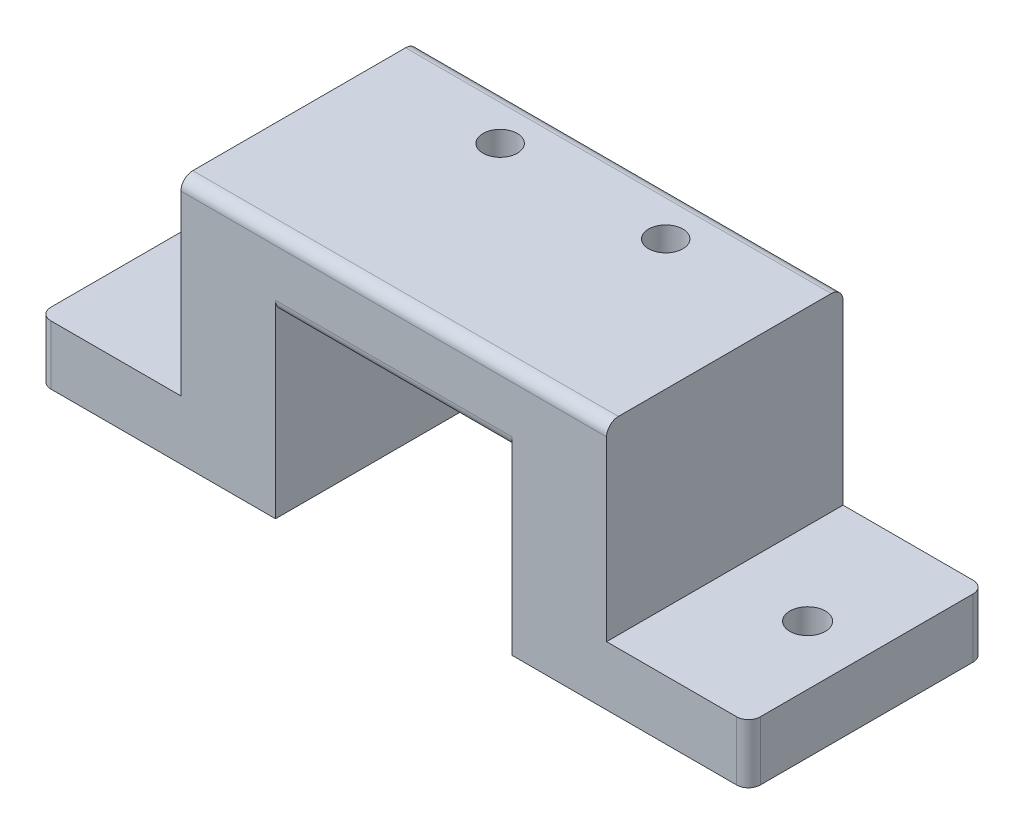
from build123d import *

# Parameters (mm, degrees)
SKETCH1_W             = 20
SKETCH1_H             = 20
SKETCH1_R             = 1.5
BOSS_EXTRUDE1_DEPTH   = 5
BOSS_EXTRUDE1_2_DEPTH = 5
SKETCH2_W             = 8
SKETCH2_H             = 20
BOSS_EXTRUDE2_DEPTH   = 10
SKETCH3_W             = 20
SKETCH3_H             = 6
BOSS_EXTRUDE3_DEPTH   = 36
CUT_EXTRUDE1_DEPTH    = 0.6
SKETCH6_W             = 24.1
SKETCH6_H             = 1.6
CUT_EXTRUDE2_DEPTH    = 17.5
FILLET1_R             = 1
SKETCH8_R             = 1.45
CUT_EXTRUDE3_DEPTH    = 6
FILLET2_R             = 1


# Some blends are built 0.0001 mm under size
with BuildPart() as part:
    # Sketch1 → Boss-Extrude1 (new body)
    with BuildSketch(Plane(origin=(0, 0, 0), x_dir=(1, 0, 0), z_dir=(0, 1, 0))):
        with Locations((-17.614620188, -5)):
            Rectangle(SKETCH1_W, SKETCH1_H)
        with Locations(Location((-22.614620188, -5, 0), (0, 0, 270))):
            Circle(SKETCH1_R, mode=Mode.SUBTRACT)
    extrude(amount=BOSS_EXTRUDE1_DEPTH)



with BuildPart() as body_2:
    # Sketch1 → Boss-Extrude1 2 (new body)
    with BuildSketch(Plane(origin=(0, 0, 0), x_dir=(1, 0, 0), z_dir=(0, 1, 0))):
        with Locations((22.385379812, -5)):
            Rectangle(SKETCH1_W, SKETCH1_H)
        with Locations(Location((27.385379812, -5, 0), (0, 0, 270))):
            Circle(SKETCH1_R, mode=Mode.SUBTRACT)
    extrude(amount=BOSS_EXTRUDE1_2_DEPTH)


with BuildPart() as part_1:
    add(part.part)

    add(body_2.part)  # Boss-Extrude2 merges body 2
    # Sketch2 → Boss-Extrude2 (add)
    with BuildSketch(Plane(origin=(0, 5, 0), x_dir=(1, 0, 0), z_dir=(0, 1, 0))):
        with Locations((-11.614620188, -5)):
            Rectangle(SKETCH2_W, SKETCH2_H)
        with Locations((16.385379812, -5)):
            Rectangle(SKETCH2_W, SKETCH2_H)
    extrude(amount=BOSS_EXTRUDE2_DEPTH)

    # Sketch3 → Boss-Extrude3 (add)
    with BuildSketch(Plane.ZY.offset(15.614620188)):
        with Locations((5, 18)):
            Rectangle(SKETCH3_W, SKETCH3_H)
    extrude(amount=-BOSS_EXTRUDE3_DEPTH)

    # Sketch4 → Cut-Extrude1 (cut)
    with BuildSketch(Plane.XZ.offset(-15)):
        with BuildLine():
            Line((5.635379812, -2.069256579), (5.635379812, -13.54882393))
            Line((5.635379812, -13.54882393), (-0.864620188, -13.54882393))
            Line((-0.864620188, -13.54882393), (-0.864620188, -2.069256579))
            ThreePointArc((-0.864620188, -2.069256579), (-1.168628736, 0.293230663), (-2.06084614, 2.501785681))
            ThreePointArc((-2.06084614, 2.501785681), (2.385379812, 10.1), (6.831605764, 2.501785681))
            ThreePointArc((6.831605764, 2.501785681), (5.93938836, 0.293230663), (5.635379812, -2.069256579))
        make_face()
    extrude(amount=-CUT_EXTRUDE1_DEPTH, mode=Mode.SUBTRACT)

    # Sketch6 → Cut-Extrude2 (cut)
    with BuildSketch(Plane(origin=(0, 0, -5), x_dir=(-1, 0, 0), z_dir=(0, 0, -1))):
        with Locations((-2.335379812, 14.2)):
            Rectangle(SKETCH6_W, SKETCH6_H)
    extrude(amount=-CUT_EXTRUDE2_DEPTH, mode=Mode.SUBTRACT)

    # Fillet1
    fillet1_edges = [part_1.edges().sort_by_distance(p)[0] for p in [
        (2.385379812, 21, -5),
        (2.385379812, 21, 15),
        (32.385379812, 2.5, 15),
        (32.385379812, 2.5, -5),
        (-27.614620188, 2.5, -5),
        (-27.614620188, 2.5, 15),
    ]]
    fillet(fillet1_edges, radius=FILLET1_R)

    # Sketch8 → Cut-Extrude3 (cut)
    with BuildSketch(Plane(origin=(0, 15, 0), x_dir=(-1, 0, 0), z_dir=(0, -1, 0))):
        with Locations(Location((4.614620188, 1, 0), (0, 0, 90))):
            Circle(SKETCH8_R)
        with Locations(Location((-9.385379812, 1, 0), (0, 0, 90))):
            Circle(SKETCH8_R)
    extrude(amount=-CUT_EXTRUDE3_DEPTH, mode=Mode.SUBTRACT)

    # Fillet2
    fillet2_edges = [part_1.edges().sort_by_distance(p)[0] for p in [
        (2.385379812, 15, 15),
    ]]
    fillet(fillet2_edges, radius=FILLET2_R)
    # the kernel refuses this fillet: 1 mm, written as the material it takes off along each edge
    with BuildSketch(Plane(origin=(1.635379812, 15, -5), x_dir=(0, 0, 1), z_dir=(-1, 0, 0))) as fillet2_2_piece_1:
        with BuildLine():
            CenterArc((FILLET2_R, FILLET2_R), FILLET2_R, 180, 90)
            Line((0, FILLET2_R), (-FILLET2_R * 0.02, FILLET2_R))
            Line((-FILLET2_R * 0.02, FILLET2_R), (-FILLET2_R * 0.02, -FILLET2_R * 0.02))
            Line((-FILLET2_R * 0.02, -FILLET2_R * 0.02), (FILLET2_R, -FILLET2_R * 0.02))
            Line((FILLET2_R, -FILLET2_R * 0.02), (FILLET2_R, 0))
        make_face()
    extrude(amount=11.35, mode=Mode.SUBTRACT)
    fillet2_3_edges = [part_1.edges().sort_by_distance(p)[0] for p in [
        (10.010379812, 15, -5),
    ]]
    fillet(fillet2_3_edges, radius=FILLET2_R - 0.0001)  # a hair under: the kernel refuses the full size


solid = part_1.part
